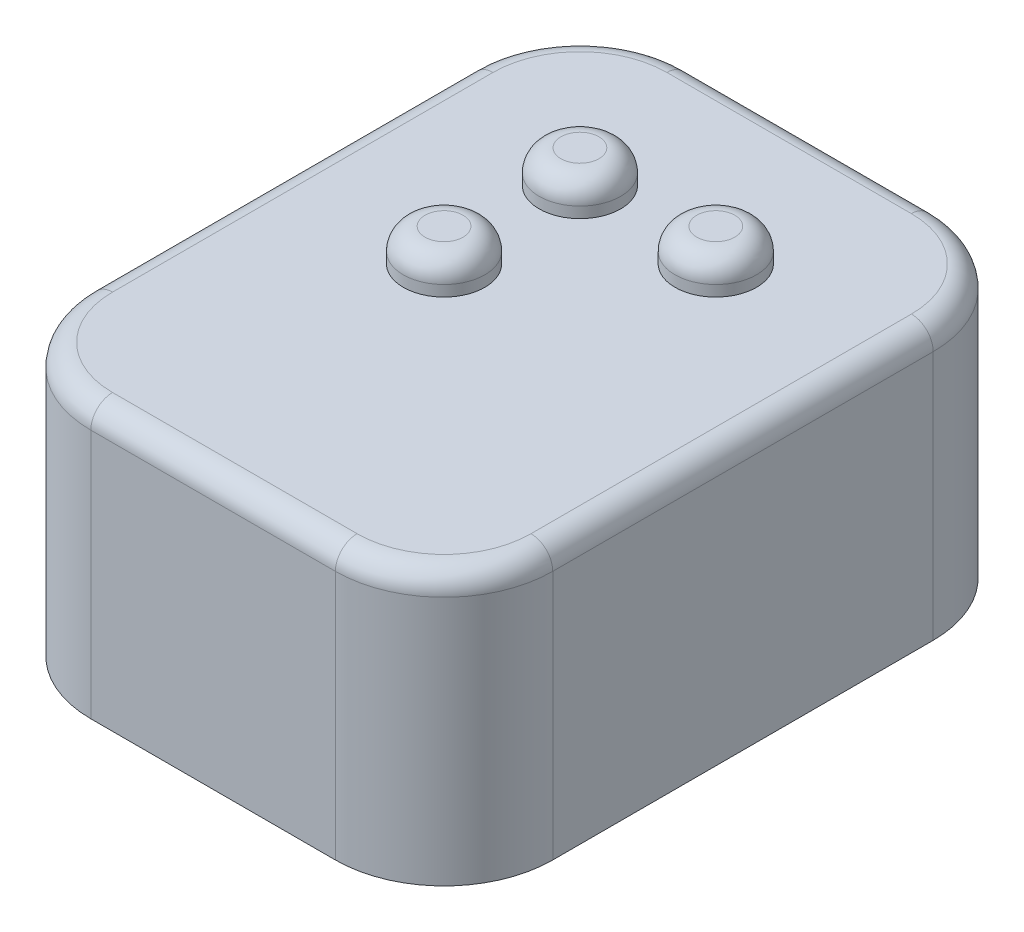
from build123d import *

# Parameters (mm, degrees)
BOSS_EXTRUDE1_DEPTH = 5
SKETCH1_3_R         = 0.75
BOSS_EXTRUDE2_DEPTH = 0.6
FILLET2_R           = 0.4
SHELL1_START        = -5
SHELL1_DEPTH        = 4
BOSS_EXTRUDE4_DEPTH = 4
SKETCH4_W           = 3.1
SKETCH4_H           = 3.1
CUT_EXTRUDE1_DEPTH  = 9.019507466
CUT_EXTRUDE1_DRAFT  = -3


# Read off the part's stored shape, not the designer's step: Shell1
with BuildPart() as part:
    # Sketch1 → Boss-Extrude1 (new body)
    with BuildSketch(Plane(origin=(0, 0, 0), x_dir=(1, 0, 0), z_dir=(0, 1, 0))):
        with BuildLine():
            Line((-2.25, -5.5), (2.25, -5.5))
            ThreePointArc((2.25, -5.5), (3.664213562, -4.914213562), (4.25, -3.5))
            Line((4.25, -3.5), (4.25, 3.5))
            ThreePointArc((4.25, 3.5), (3.664213562, 4.914213562), (2.25, 5.5))
            Line((2.25, 5.5), (-2.25, 5.5))
            ThreePointArc((-2.25, 5.5), (-3.664213562, 4.914213562), (-4.25, 3.5))
            Line((-4.25, 3.5), (-4.25, -3.5))
            ThreePointArc((-4.25, -3.5), (-3.664213562, -4.914213562), (-2.25, -5.5))
        make_face()
    extrude(amount=-BOSS_EXTRUDE1_DEPTH)

    # Sketch1<3> → Boss-Extrude2 (add)
    with BuildSketch(Plane(origin=(0, 0, 0), x_dir=(1, 0, 0), z_dir=(0, 1, 0))):
        with Locations(Location((1.25, 2.5, 0), (0, 0, 270))):
            Circle(SKETCH1_3_R)
        with Locations(Location((-1.25, 0, 0), (0, 0, 270))):
            Circle(SKETCH1_3_R)
        with Locations(Location((-1.25, 2.5, 0), (0, 0, 270))):
            Circle(SKETCH1_3_R)
    extrude(amount=BOSS_EXTRUDE2_DEPTH)

    # Fillet2
    fillet2_edges = [part.edges().sort_by_distance(p)[0] for p in [
        (3.664213562, 0, -4.914213562),
        (4.25, 0, 0),
        (3.664213562, 0, 4.914213562),
        (0, 0, 5.5),
        (-1.25, 0.6, -3.25),
        (-1.25, 0.6, -0.75),
        (1.25, 0.6, -3.25),
        (-3.664213562, 0, 4.914213562),
        (-4.25, 0, 0),
        (-3.664213562, 0, -4.914213562),
        (0, 0, -5.5),
    ]]
    fillet(fillet2_edges, radius=FILLET2_R)

    # Shell1 outline → Shell1 (cut)
    with BuildSketch(Plane(origin=(0, 0, 0), x_dir=(1, 0, 0), z_dir=(0, 1, 0)).offset(SHELL1_START)):
        with BuildLine():
            ThreePointArc((-2.75, -3.5), (-2.603553391, -3.853553391), (-2.25, -4))
            Line((-2.25, -4), (2.25, -4))
            ThreePointArc((2.25, -4), (2.603553391, -3.853553391), (2.75, -3.5))
            Line((2.75, -3.5), (2.75, 3.5))
            ThreePointArc((2.75, 3.5), (2.603553391, 3.853553391), (2.25, 4))
            Line((2.25, 4), (-2.25, 4))
            ThreePointArc((-2.25, 4), (-2.603553391, 3.853553391), (-2.75, 3.5))
            Line((-2.75, 3.5), (-2.75, -3.5))
        make_face()
    extrude(amount=SHELL1_DEPTH, mode=Mode.SUBTRACT)

    # Sketch3 → Boss-Extrude4 (add)
    with BuildSketch(Plane.XZ.offset(1)):
        Polygon((-1, 4), (1, 4), (1, 1), (2.75, 1), (2.75, -1), (1, -1), (1, -4), (-1, -4), (-1, -1), (-2.75, -1), (-2.75, 1), (-1, 1), align=None)
    extrude(amount=BOSS_EXTRUDE4_DEPTH)


with BuildPart() as cut_extrude1_tool:
    # Sketch4 → Cut-Extrude1 (with draft: the straight prism first)
    with BuildSketch(Plane.XZ.offset(1)):
        Rectangle(SKETCH4_W, SKETCH4_H)
    extrude(amount=CUT_EXTRUDE1_DEPTH)
    # Cut-Extrude1: the draft: its side faces are tilted about the plane it starts from
    cut_extrude1_sides = [cut_extrude1_tool.faces().sort_by_distance(p)[0] for p in [
        (0, -5.509753733, -1.55),
        (1.55, -5.509753733, 0),
        (0, -5.509753733, 1.55),
        (-1.55, -5.509753733, 0),
    ]]
    draft(cut_extrude1_sides, Plane.XZ.offset(1), CUT_EXTRUDE1_DRAFT)


with BuildPart() as part_1:
    add(part.part)

    # Cut-Extrude1: cut by cut_extrude1_tool
    add(cut_extrude1_tool.part, mode=Mode.SUBTRACT)


solid = part_1.part
